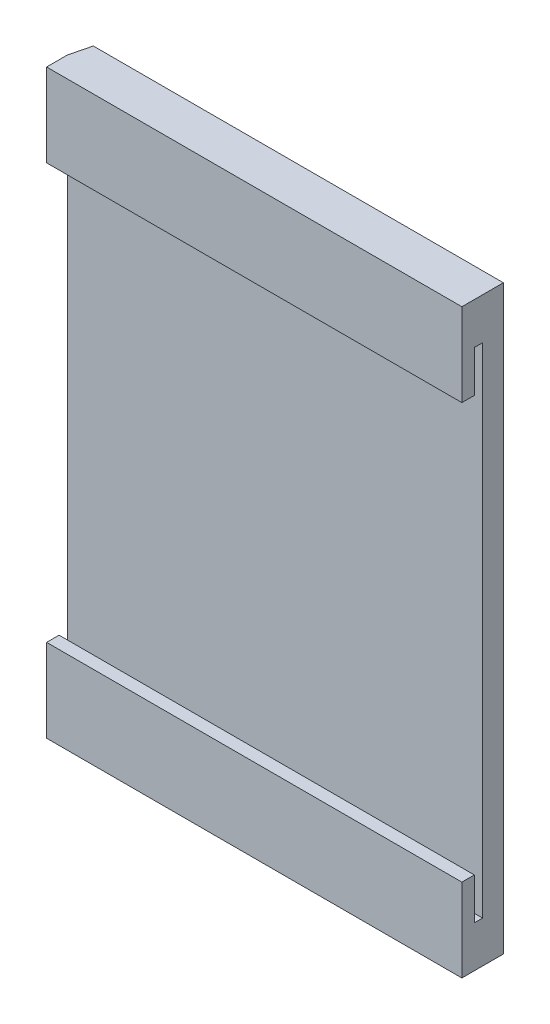
from build123d import *

# Parameters (mm, degrees)
BOSS_EXTRUDE1_DEPTH      = 5
BOSS_EXTRUDE1_DEPTH_BACK = 5
SKETCH1_W                = 100
SKETCH1_H                = 140
SKETCH1_3_W              = 100
SKETCH1_3_H              = 100
CUT_EXTRUDE1_DEPTH       = 123.167917229
SKETCH1_4_W              = 100
SKETCH1_4_H              = 10
CUT_EXTRUDE2_DEPTH       = 2
CUT_EXTRUDE3_DEPTH       = 123.167917229
CUT_EXTRUDE3_DEPTH_BACK  = 123.167917229


with BuildPart() as part:
    # Sketch1 → Boss-Extrude1 (new, two sides: drawn at the far end of the back side and taken through both)
    with BuildSketch(Plane.XY.offset(-BOSS_EXTRUDE1_DEPTH_BACK)):
        with Locations((50, 0)):
            Rectangle(SKETCH1_W, SKETCH1_H)
    extrude(amount=BOSS_EXTRUDE1_DEPTH + BOSS_EXTRUDE1_DEPTH_BACK)

    # Sketch1<3> → Cut-Extrude1 (cut, through all)
    with BuildSketch(Plane.XY):
        with Locations((50, 0)):
            Rectangle(SKETCH1_3_W, SKETCH1_3_H)
    extrude(amount=CUT_EXTRUDE1_DEPTH, mode=Mode.SUBTRACT)

    # Sketch1<4> → Cut-Extrude2 (cut)
    with BuildSketch(Plane.XY):
        with Locations((50, 55)):
            Rectangle(SKETCH1_4_W, SKETCH1_4_H)
        with Locations((50, -55)):
            Rectangle(SKETCH1_4_W, SKETCH1_4_H)
    extrude(amount=CUT_EXTRUDE2_DEPTH, mode=Mode.SUBTRACT)

    # Sketch2 → Cut-Extrude3 (cut, two sides: drawn at the far end of the back side and taken through both)
    with BuildSketch(Plane(origin=(0, 0, 0), x_dir=(1, 0, 0), z_dir=(0, 1, 0)).offset(-CUT_EXTRUDE3_DEPTH_BACK)):
        Polygon((0, 0), (7.5, 30), (0, 30), align=None)
    extrude(amount=CUT_EXTRUDE3_DEPTH + CUT_EXTRUDE3_DEPTH_BACK, mode=Mode.SUBTRACT)


solid = part.part
